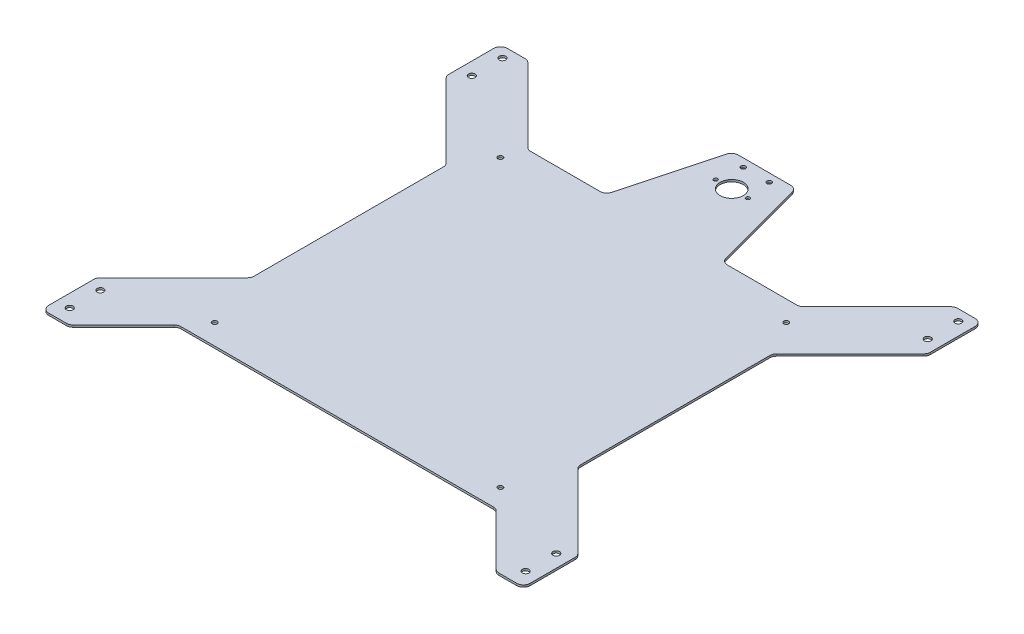
from build123d import *

# Parameters (mm, degrees)
SKETCH1_W            = 350
SKETCH1_H            = 347
BASE_FLANGE1_DEPTH   = 1.51892
M3_CLEARANCE_HOLE1_D = 3.6
M4_CLEARANCE_HOLE1_D = 4.8
SKETCH13_R           = 8.5
SKETCH13_R_2         = 1.375
CUT_EXTRUDE1_DEPTH   = 1.51892
SKETCH41_W           = 347
SKETCH41_H           = 1.51892
BOSS_EXTRUDE4_DEPTH  = 1.905
SKETCH42_W           = 347
SKETCH42_H           = 1.51892
BOSS_EXTRUDE5_DEPTH  = 1.905
CUT_EXTRUDE2_DEPTH   = 1.51892
BOSS_EXTRUDE6_DEPTH  = 1.51892
CLEARANCE_HOLE2_D    = 3.4
FILLET2_R            = 5


# Sheet-metal steps are written as plain solids
with BuildPart() as part:
    # Sketch1 → Base-Flange1 (new body)
    with BuildSketch(Plane(origin=(0, 0, 0), x_dir=(1, 0, 0), z_dir=(0, 1, 0))):
        with Locations((0, 13.5)):
            Rectangle(SKETCH1_W, SKETCH1_H)
    extrude(amount=-BASE_FLANGE1_DEPTH)

    # M3 Clearance Hole1 (through all)
    with Locations(Plane(origin=(0, 0, 0), x_dir=(1, 0, 0), z_dir=(0, 1, 0))):
        with Locations((-105, 105), (105, 105), (105, -105), (-105, -105)):
            Hole(M3_CLEARANCE_HOLE1_D / 2)

    # M4 Clearance Hole1 (through all)
    with Locations(Plane(origin=(0, -1.51892, 0), x_dir=(-1, 0, 0), z_dir=(0, -1, 0))):
        with Locations((167.5, 146.5), (167.5, 169), (-167.5, 146.5), (-167.5, 169), (-167.5, -149), (-167.5, -126.5), (167.5, -149), (167.5, -126.5)):
            Hole(M4_CLEARANCE_HOLE1_D / 2)

    # Sketch13 → Cut-Extrude1 (cut)
    with BuildSketch(Plane(origin=(0, 0, 0), x_dir=(1, 0, 0), z_dir=(0, 1, 0))):
        with Locations(Location((0, 170, 0), (0, 0, 270))):
            Circle(SKETCH13_R)
        with Locations(Location((-11.825, 170, 0), (0, 0, 270))):
            Circle(SKETCH13_R_2)
        with Locations(Location((11.825, 170, 0), (0, 0, 270))):
            Circle(SKETCH13_R_2)
    extrude(amount=-CUT_EXTRUDE1_DEPTH, mode=Mode.SUBTRACT)

    # Sketch41 → Boss-Extrude4 (add)
    with BuildSketch(Plane(origin=(175, 0, 0), x_dir=(0, 0, -1), z_dir=(1, 0, 0))):
        with Locations((13.5, -0.75946)):
            Rectangle(SKETCH41_W, SKETCH41_H)
    extrude(amount=BOSS_EXTRUDE4_DEPTH)

    # Sketch42 → Boss-Extrude5 (add)
    with BuildSketch(Plane.ZY.offset(175)):
        with Locations((-13.5, -0.75946)):
            Rectangle(SKETCH42_W, SKETCH42_H)
    extrude(amount=BOSS_EXTRUDE5_DEPTH)

    # Sketch43 → Cut-Extrude2 (cut)
    with BuildSketch(Plane(origin=(0, 0, 0), x_dir=(1, 0, 0), z_dir=(0, 1, 0))):
        Polygon((-176.905, -120), (-120, -63.095), (-120, 80.095), (-176.905, 137), align=None)
        Polygon((-156.905, 177), (-99.905, 120), (-42.952595893, 120), (-25, 187), (-176.905, 187), (-176.905, 177), align=None)
        Polygon((25, 187), (42.952595893, 120), (99.905, 120), (156.905, 177), (176.905, 177), (176.905, 187), align=None)
        Polygon((120, 80.095), (120, -63.095), (176.905, -120), (176.905, 137), align=None)
        Polygon((116.905, -120), (-116.905, -120), (-156.905, -160), (156.905, -160), align=None)
    extrude(amount=-CUT_EXTRUDE2_DEPTH, mode=Mode.SUBTRACT)

    # Sketch45 → Boss-Extrude6 (add)
    with BuildSketch(Plane(origin=(0, 0, 0), x_dir=(1, 0, 0), z_dir=(0, 1, 0))):
        Polygon((-25, 187), (-23.124355653, 194), (23.124355653, 194), (25, 187), align=None)
    extrude(amount=-BOSS_EXTRUDE6_DEPTH)

    # Clearance Hole2 (through all)
    with Locations(Plane(origin=(0, 0, 0), x_dir=(1, 0, 0), z_dir=(0, 1, 0))):
        with Locations((-9.525, 188), (9.525, 188)):
            Hole(CLEARANCE_HOLE2_D / 2)

    # Fillet2
    fillet2_edges = [part.edges().sort_by_distance(p)[0] for p in [
        (176.905, -0.75946, 160),
        (-176.905, -0.75946, 160),
        (176.905, -0.75946, -177),
        (42.952595893, -0.75946, -120),
        (99.905, -0.75946, -120),
        (156.905, -0.75946, -177),
        (176.905, -0.75946, 120),
        (176.905, -0.75946, -137),
        (120, -0.75946, -80.095),
        (120, -0.75946, 63.095),
        (-176.905, -0.75946, -137),
        (-176.905, -0.75946, 120),
        (-120, -0.75946, 63.095),
        (-120, -0.75946, -80.095),
        (-176.905, -0.75946, -177),
        (-156.905, -0.75946, -177),
        (-99.905, -0.75946, -120),
        (-42.952595893, -0.75946, -120),
        (-156.905, -0.75946, 160),
        (156.905, -0.75946, 160),
        (116.905, -0.75946, 120),
        (-116.905, -0.75946, 120),
        (-23.124355653, -0.75946, -194),
        (23.124355653, -0.75946, -194),
    ]]
    fillet(fillet2_edges, radius=FILLET2_R)


solid = part.part
